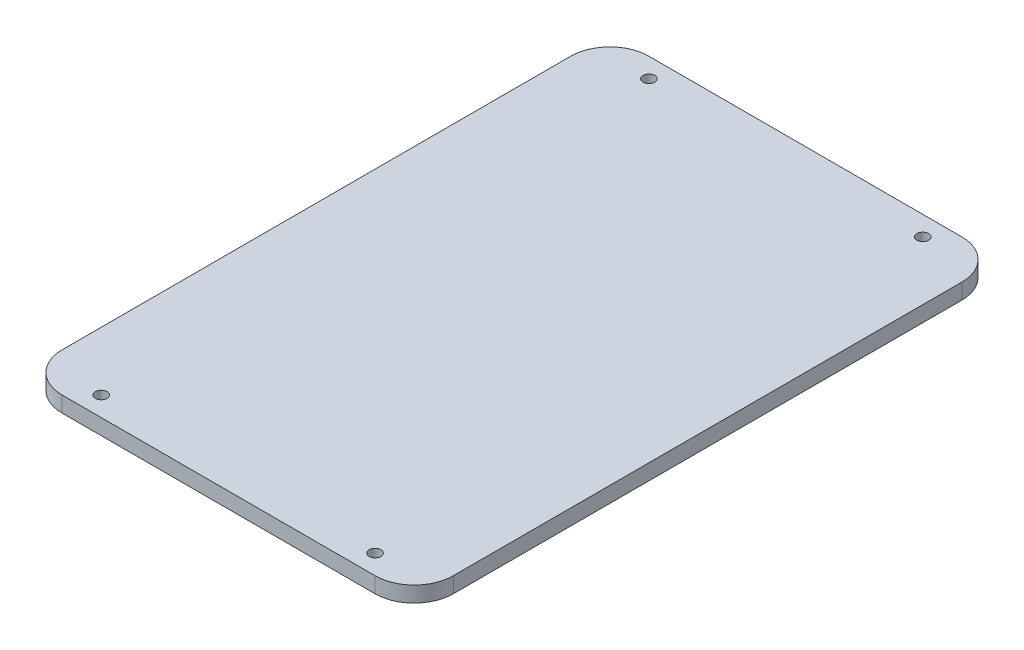
from build123d import *

# Parameters (mm, degrees)
SKETCH_1_W      = 100
SKETCH_1_H      = 150
SKETCH_1_R      = 1.5
EXTRUDE_1_DEPTH = 4
FILLET_1_R      = 10


with BuildPart() as part:
    # 草图1 → 凸台-拉伸1 (new body)
    with BuildSketch(Plane(origin=(0, 0, 0), x_dir=(1, 0, 0), z_dir=(0, 1, 0))):
        Rectangle(SKETCH_1_W, SKETCH_1_H)
        with Locations((35, 70)):
            Circle(SKETCH_1_R, mode=Mode.SUBTRACT)
        with Locations((-35, 70)):
            Circle(SKETCH_1_R, mode=Mode.SUBTRACT)
        with Locations((-35, -70)):
            Circle(SKETCH_1_R, mode=Mode.SUBTRACT)
        with Locations((35, -70)):
            Circle(SKETCH_1_R, mode=Mode.SUBTRACT)
    extrude(amount=EXTRUDE_1_DEPTH)

    # 圆角1
    fillet_1_edges = [part.edges().sort_by_distance(p)[0] for p in [
        (-50, 2, 75),
        (-50, 2, -75),
        (50, 2, -75),
        (50, 2, 75),
    ]]
    fillet(fillet_1_edges, radius=FILLET_1_R)


solid = part.part
